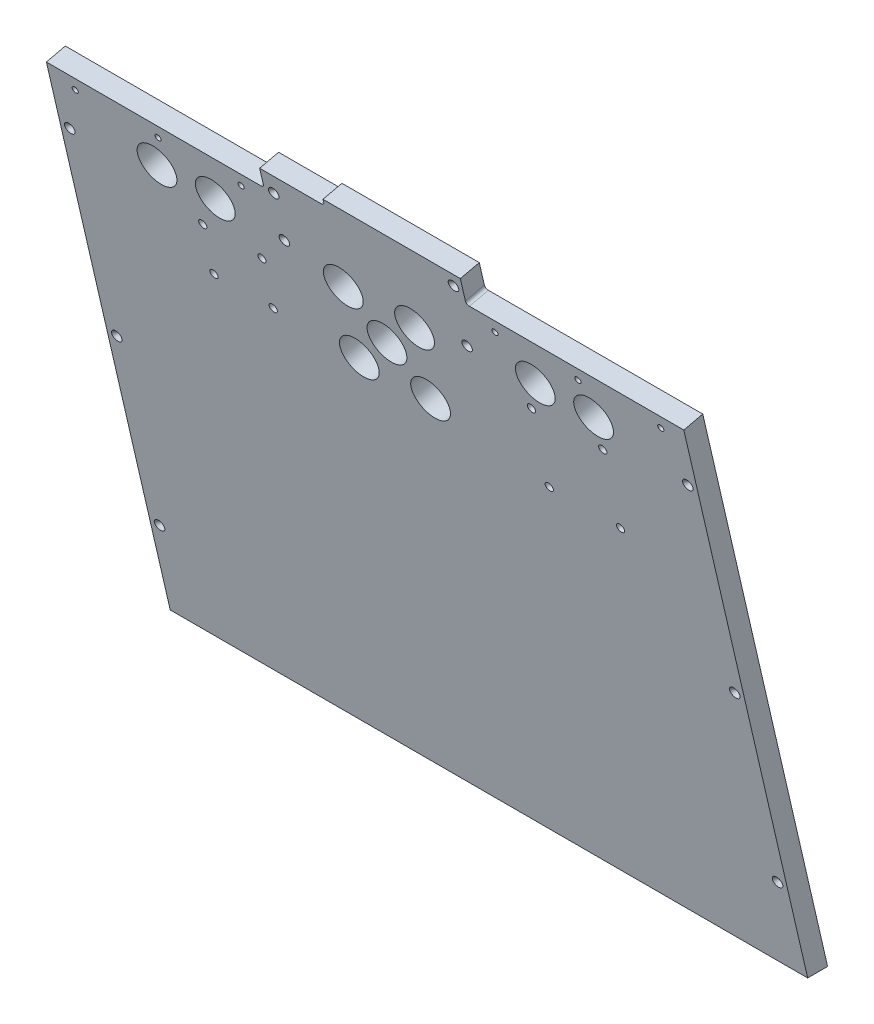
from build123d import *

# Parameters (mm, degrees)
CUT_EXTRUDE1_START                                = -312.42
CUT_EXTRUDE1_DEPTH                                = 624.84
CUT_EXTRUDE1_2_DEPTH                              = 213.36
CUT_EXTRUDE1_START_2                              = 99.06
CUT_EXTRUDE1_3_DEPTH                              = 213.36
SKETCH4_W                                         = 213.36
SKETCH4_H                                         = 19.05
CUT_EXTRUDE2_DEPTH                                = 15.875
CUT_EXTRUDE3_REACH                                = 6365.401
SKETCH6_W                                         = 213.36
SKETCH6_H                                         = 25.4
CUT_EXTRUDE4_REACH                                = 6365.376
SKETCH7_W                                         = 63.5
SKETCH7_H                                         = 19.05
F_15_64_0_23438_DIAMETER_HOLE1_D                  = 5.953252
F_15_64_0_23438_DIAMETER_HOLE1_DEPTH              = 143.882100426
SKETCH10_W                                        = 134.62
SKETCH10_H                                        = 19.05
CUT_EXTRUDE5_DEPTH                                = 12.781375044
F_5_16_0_3125_DIAMETER_HOLE1_D                    = 7.9375
CSK_FOR_8_FLAT_HEAD_MACHINE_SCREW_100_D           = 4.9149
CSK_FOR_8_FLAT_HEAD_MACHINE_SCREW_100_CSINK_D     = 8.4328
CSK_FOR_8_FLAT_HEAD_MACHINE_SCREW_100_CSINK_ANGLE = 100
FILLET1_R                                         = 3.175
HOLE2_D                                           = 38.1


with BuildPart() as part:
    # Cut-Extrude1: read off the stored shape, not the designer's step
    # Cut-Extrude1 outline → Cut-Extrude1 (new body)
    with BuildSketch(Plane.YZ.offset(CUT_EXTRUDE1_START)):
        Polygon((5761.678510384, 3278.576208456), (5757.393192798, 3297.13795819), (5194.3, 3167.137651334), (5194.3, 3147.58655808), align=None)
    extrude(amount=CUT_EXTRUDE1_DEPTH)

    # Cut-Extrude1 2 outline → Cut-Extrude1 2 (add)
    with BuildSketch(Plane.YZ.offset(CUT_EXTRUDE1_START)):
        Polygon((5764.692845932, 3279.272122652), (5760.407528347, 3297.833872386), (5757.393192798, 3297.13795819), (5761.678510384, 3278.576208456), align=None)
    extrude(amount=CUT_EXTRUDE1_2_DEPTH)

    # Cut-Extrude1 3 outline → Cut-Extrude1 3 (add)
    with BuildSketch(Plane.YZ.offset(CUT_EXTRUDE1_START_2)):
        Polygon((5764.692845932, 3279.272122652), (5760.407528347, 3297.833872386), (5757.393192798, 3297.13795819), (5761.678510384, 3278.576208456), align=None)
    extrude(amount=CUT_EXTRUDE1_3_DEPTH)

    # Hole1: read off the stored shape, not the designer's step
    # Hole1 outline → Hole1 (revolve, cut)
    with BuildSketch(Plane(origin=(-302.895, 6093.262295212, 1406.740444149), x_dir=(1, 0, 0), z_dir=(0, 0.9743700647852487, 0.2249510543438069))):
        Polygon((0.99187, -1912.798001339), (0.99187, -1898.450856936), (0, -1898.450856936), (0, -1917.500856936), (5.08, -1917.500856936), align=None)
    revolve(axis=Axis((-302.895, 6093.262295212, 1406.740444149), (0, 0.2249510543438069, -0.9743700647852487)), mode=Mode.SUBTRACT)

    # Hole1 2 outline → Hole1 2 (revolve, cut)
    with BuildSketch(Plane(origin=(-302.895, 5893.938311596, 1360.722876603), x_dir=(1, 0, 0), z_dir=(0, 0.9743700647852487, 0.2249510543438069))):
        Polygon((0.99187, -1912.798001339), (0.99187, -1898.450856936), (0, -1898.450856936), (0, -1917.500856936), (5.08, -1917.500856936), align=None)
    revolve(axis=Axis((-302.895, 5893.938311596, 1360.722876603), (0, 0.2249510543438069, -0.9743700647852487)), mode=Mode.SUBTRACT)

    # Hole1 3 outline → Hole1 3 (revolve, cut)
    with BuildSketch(Plane(origin=(-302.895, 5712.292431, 1318.786620725), x_dir=(1, 0, 0), z_dir=(0, 0.9743700647852487, 0.2249510543438069))):
        Polygon((0.99187, -1912.798001339), (0.99187, -1898.450856936), (0, -1898.450856936), (0, -1917.500856936), (5.08, -1917.500856936), align=None)
    revolve(axis=Axis((-302.895, 5712.292431, 1318.786620725), (0, 0.2249510543438069, -0.9743700647852487)), mode=Mode.SUBTRACT)

    # Hole1 4 outline → Hole1 4 (revolve, cut)
    with BuildSketch(Plane(origin=(-89.535, 6151.613532803, 1420.211888821), x_dir=(1, 0, 0), z_dir=(0, 0.9743700647852487, 0.2249510543438069))):
        Polygon((0.99187, -1912.798001339), (0.99187, -1898.450856936), (0, -1898.450856936), (0, -1917.500856936), (5.08, -1917.500856936), align=None)
    revolve(axis=Axis((-89.535, 6151.613532803, 1420.211888821), (0, 0.2249510543438069, -0.9743700647852487)), mode=Mode.SUBTRACT)

    # Hole1 5 outline → Hole1 5 (revolve, cut)
    with BuildSketch(Plane(origin=(-89.535, 6106.319771445, 1409.755000067), x_dir=(1, 0, 0), z_dir=(0, 0.9743700647852487, 0.2249510543438069))):
        Polygon((0.99187, -1912.798001339), (0.99187, -1898.450856936), (0, -1898.450856936), (0, -1917.500856936), (5.08, -1917.500856936), align=None)
    revolve(axis=Axis((-89.535, 6106.319771445, 1409.755000067), (0, 0.2249510543438069, -0.9743700647852487)), mode=Mode.SUBTRACT)

    # Hole1 6 outline → Hole1 6 (revolve, cut)
    with BuildSketch(Plane(origin=(89.535, 6106.319771445, 1409.755000067), x_dir=(1, 0, 0), z_dir=(0, 0.9743700647852487, 0.2249510543438069))):
        Polygon((0.99187, -1912.798001339), (0.99187, -1898.450856936), (0, -1898.450856936), (0, -1917.500856936), (5.08, -1917.500856936), align=None)
    revolve(axis=Axis((89.535, 6106.319771445, 1409.755000067), (0, 0.2249510543438069, -0.9743700647852487)), mode=Mode.SUBTRACT)

    # Hole1 7 outline → Hole1 7 (revolve, cut)
    with BuildSketch(Plane(origin=(89.535, 6163.988032626, 1423.068767212), x_dir=(1, 0, 0), z_dir=(0, 0.9743700647852487, 0.2249510543438069))):
        Polygon((0.99187, -1912.798001339), (0.99187, -1898.450856936), (0, -1898.450856936), (0, -1917.500856936), (5.08, -1917.500856936), align=None)
    revolve(axis=Axis((89.535, 6163.988032626, 1423.068767212), (0, 0.2249510543438069, -0.9743700647852487)), mode=Mode.SUBTRACT)

    # Hole1 8 outline → Hole1 8 (revolve, cut)
    with BuildSketch(Plane(origin=(302.895, 5712.292431, 1318.786620725), x_dir=(1, 0, 0), z_dir=(0, 0.9743700647852487, 0.2249510543438069))):
        Polygon((0.99187, -1912.798001339), (0.99187, -1898.450856936), (0, -1898.450856936), (0, -1917.500856936), (5.08, -1917.500856936), align=None)
    revolve(axis=Axis((302.895, 5712.292431, 1318.786620725), (0, 0.2249510543438069, -0.9743700647852487)), mode=Mode.SUBTRACT)

    # Hole1 9 outline → Hole1 9 (revolve, cut)
    with BuildSketch(Plane(origin=(302.895, 5893.938311596, 1360.722876603), x_dir=(1, 0, 0), z_dir=(0, 0.9743700647852487, 0.2249510543438069))):
        Polygon((0.99187, -1912.798001339), (0.99187, -1898.450856936), (0, -1898.450856936), (0, -1917.500856936), (5.08, -1917.500856936), align=None)
    revolve(axis=Axis((302.895, 5893.938311596, 1360.722876603), (0, 0.2249510543438069, -0.9743700647852487)), mode=Mode.SUBTRACT)

    # Hole1 10 outline → Hole1 10 (revolve, cut)
    with BuildSketch(Plane(origin=(302.895, 6093.262295212, 1406.740444149), x_dir=(1, 0, 0), z_dir=(0, 0.9743700647852487, 0.2249510543438069))):
        Polygon((0.99187, -1912.798001339), (0.99187, -1898.450856936), (0, -1898.450856936), (0, -1917.500856936), (5.08, -1917.500856936), align=None)
    revolve(axis=Axis((302.895, 6093.262295212, 1406.740444149), (0, 0.2249510543438069, -0.9743700647852487)), mode=Mode.SUBTRACT)

    # Sketch4 → Cut-Extrude2 (cut)
    with BuildSketch(Plane(origin=(0, 6191.75136782, 1429.478438187), x_dir=(1, 0, 0), z_dir=(0, 0.9743700647852486, 0.2249510543438069))):
        with Locations((-205.74, -1907.975856936)):
            Rectangle(SKETCH4_W, SKETCH4_H)
        with Locations((205.74, -1907.975856936)):
            Rectangle(SKETCH4_W, SKETCH4_H)
    extrude(amount=-CUT_EXTRUDE2_DEPTH, mode=Mode.SUBTRACT)

    # Sketch6 → Cut-Extrude3 (cut, up to next)
    with BuildSketch(Plane(origin=(0, -427.058521888, 1849.793684464), x_dir=(-1, 0, 0), z_dir=(0, 0.2249510543438069, -0.9743700647852486)), mode=Mode.PRIVATE) as cut_extrude3_sk1:
        with Locations((205.74, 6326.044863229)):
            Rectangle(SKETCH6_W, SKETCH6_H)
    cut_extrude3_tool1 = extrude(cut_extrude3_sk1.sketch, amount=-CUT_EXTRUDE3_REACH, mode=Mode.PRIVATE) & part.part
    cut_extrude3 = cut_extrude3_tool1.solids().sort_by_distance((-205.74, 5736.850221, 3272.844146))[0]
    add(cut_extrude3, mode=Mode.SUBTRACT)

    # Sketch7 → Cut-Extrude4 (cut, up to next)
    with BuildSketch(Plane(origin=(0, -431.343839473, 1868.355434198), x_dir=(1, 0, 0), z_dir=(0, -0.2249510543438069, 0.9743700647852486)), mode=Mode.PRIVATE) as cut_extrude4_sk1:
        with Locations((-67.31, 6342.001238273)):
            Rectangle(SKETCH7_W, SKETCH7_H)
    cut_extrude4_tool1 = extrude(cut_extrude4_sk1.sketch, amount=-CUT_EXTRUDE4_REACH, mode=Mode.PRIVATE) & part.part
    add(cut_extrude4_tool1.solids().sort_by_distance((-67.31, 5748.112318, 3294.995299))[0], mode=Mode.SUBTRACT)

    # 15/64 (0.23438) Diameter Hole1
    with Locations(Plane(origin=(0, -431.343839473, 1868.355434198), x_dir=(1, 0, 0), z_dir=(0, -0.2249510543438069, 0.9743700647852486))):
        with Locations((-287.02, 6300.644863229), (-205.74, 6300.644863229), (-124.46, 6300.644863229)):
            f_15_64_0_23438_diameter_hole1 = Hole(F_15_64_0_23438_DIAMETER_HOLE1_D / 2, depth=F_15_64_0_23438_DIAMETER_HOLE1_DEPTH)

    # Sketch10 → Cut-Extrude5 (cut)
    with BuildSketch(Plane(origin=(0, 6188.737032271, 1428.782523993), x_dir=(1, 0, 0), z_dir=(0, 0.9743700647851962, 0.22495105434403417))):
        with Locations((31.75, -1907.975856934)):
            Rectangle(SKETCH10_W, SKETCH10_H)
    extrude(amount=-CUT_EXTRUDE5_DEPTH, mode=Mode.SUBTRACT)

    # 5/16 (0.3125) Diameter Hole1 (through all)
    with Locations(Plane(origin=(0, -427.058521888, 1849.793684464), x_dir=(-1, 0, 0), z_dir=(0, 0.22495105434380694, -0.9743700647852487))):
        with Locations((177.4383, 6182.859863229), (119.4383, 6182.859863229), (119.4383, 6231.859863229), (177.4383, 6231.859863229), (-216.0524, 6238.287863229), (-146.2024, 6238.287863229), (-146.2024, 6160.817863229), (-216.0524, 6160.817863229)):
            Hole(F_5_16_0_3125_DIAMETER_HOLE1_D / 2)

    # CSK for #8 Flat Head Machine Screw (100)1 (through all)
    with Locations(Plane(origin=(0, -431.343839473, 1868.355434198), x_dir=(1, 0, 0), z_dir=(0, -0.22495105434380694, 0.9743700647852487))):
        with Locations((118.639166667, 6322.150813261)):
            CounterSinkHole(CSK_FOR_8_FLAT_HEAD_MACHINE_SCREW_100_D / 2, CSK_FOR_8_FLAT_HEAD_MACHINE_SCREW_100_CSINK_D / 2, counter_sink_angle=CSK_FOR_8_FLAT_HEAD_MACHINE_SCREW_100_CSINK_ANGLE)

    # Mirror1: Cut-Extrude3, 15/64 (0.23438) Diameter Hole1 across plane
    add(cut_extrude3.mirror(Plane(origin=(0, 0, 0), x_dir=(0, 0, 1), z_dir=(1, 0, 0))), mode=Mode.SUBTRACT)
    add(f_15_64_0_23438_diameter_hole1.mirror(Plane(origin=(0, 0, 0), x_dir=(0, 0, 1), z_dir=(1, 0, 0))), mode=Mode.SUBTRACT)

    # Fillet1
    fillet1_edges = [part.edges().sort_by_distance(p)[0] for p in [
        (-99.06, 5722.333062716, 3279.268142751),
        (-35.56, 5740.974101857, 3283.571765738),
        (99.06, 5722.333062716, 3279.268142751),
    ]]
    fillet(fillet1_edges, radius=FILLET1_R)

    # Hole2 (through all)
    with Locations(Plane(origin=(0, -431.343839473, 1868.355434198), x_dir=(1, 0, 0), z_dir=(0, -0.22495105434380694, 0.9743700647852487))):
        with Locations((0, 6218.121381434), (34.925, 6183.196381434), (-34.925, 6253.046381434), (-34.925, 6183.196381434), (34.925, 6253.046381434), (-213.995, 6268.921381434), (-156.845, 6268.921381434), (156.845, 6268.921381434), (213.995, 6268.921381434)):
            Hole(HOLE2_D / 2)


solid = part.part
